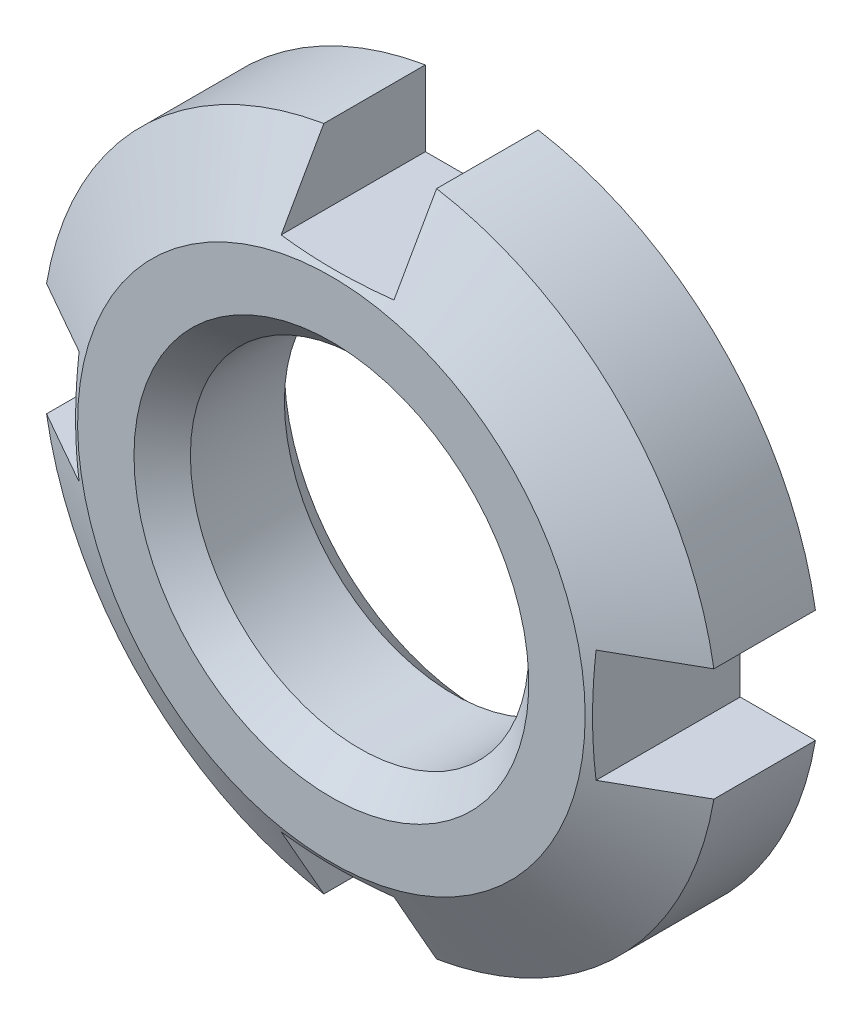
from build123d import *

# Parameters (mm, degrees)
SLOTSKE_W        = 3
SLOTSKE_H        = 3
CUTSLOT_DEPTH    = 14.341664064
SLOTPAT_COUNT    = 4
HOLESKE_R        = 4.5
TAPPEDHOLE_DEPTH = 14.171939872
CHAMFER1_SIZE    = 0.75


with BuildPart() as part:
    # BaseNutSke → BaseNut (revolve)
    with BuildSketch(Plane(origin=(0, 0, 0), x_dir=(1, 0, 0), z_dir=(0, 1, 0))):
        Polygon((-6.75, -4), (0, -4), (0, 0), (-9, 0), (-9, -2.700961894), align=None)
    revolve(axis=Axis((0, 0, 0), (0, 0, -1)))

    # SlotSke → CutSlot (cut, through all)
    with BuildSketch(Plane.XY):
        with Locations((0, 8.374119675)):
            Rectangle(SLOTSKE_W, SLOTSKE_H)
    cutslot = extrude(amount=CUTSLOT_DEPTH, mode=Mode.SUBTRACT)

    # SlotPat: CutSlot ×4 about axis
    slotpat_axis = Axis((0, 0, 0), (0, 0, -1))
    for i in range(1, SLOTPAT_COUNT):
        add(cutslot.rotate(slotpat_axis, i * 360 / SLOTPAT_COUNT), mode=Mode.SUBTRACT)

    # HoleSke → TappedHole (cut, through all)
    with BuildSketch(Plane.XY):
        Circle(HOLESKE_R)
    extrude(amount=TAPPEDHOLE_DEPTH, mode=Mode.SUBTRACT)

    # Chamfer1
    chamfer1_edges = [part.edges().sort_by_distance(p)[0] for p in [
        (-4.5, 0, 0),
        (-4.5, 0, 4),
    ]]
    chamfer(chamfer1_edges, length=CHAMFER1_SIZE)


solid = part.part
